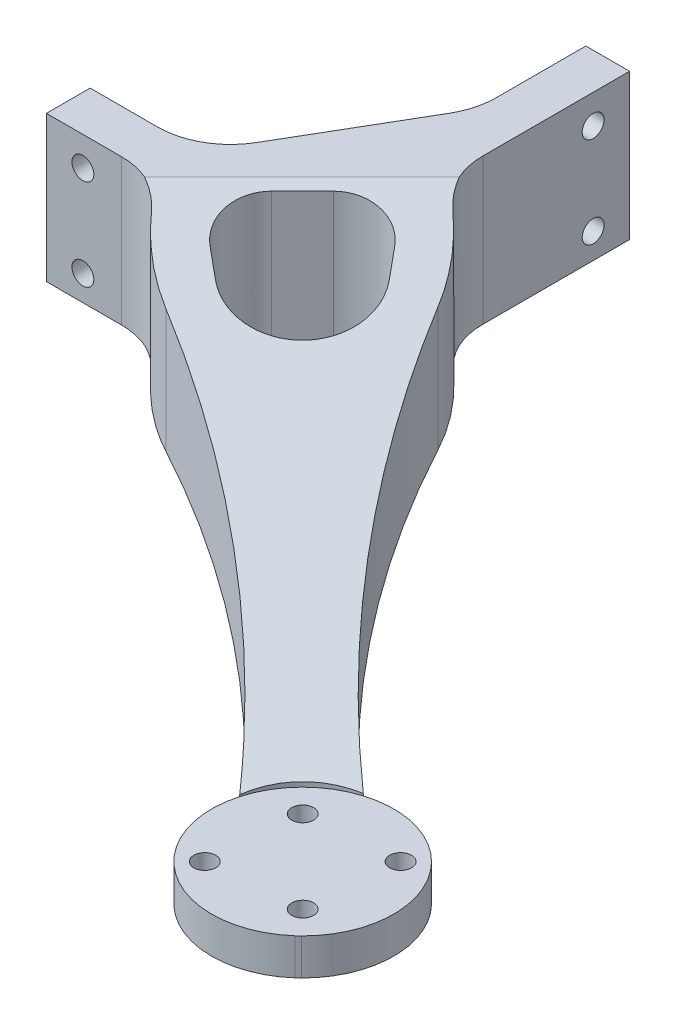
from build123d import *

# Parameters (mm, degrees)
BOSS_EXTRUDE3_DEPTH     = 25
FILLET2_R               = 30
SKETCH2_R               = 1.5
CUT_EXTRUDE1_DEPTH      = 25
SKETCH3_R               = 1.5
CUT_EXTRUDE2_DEPTH      = 25
CUT_EXTRUDE4_DEPTH      = 25
FILLET3_R               = 6
BOSS_EXTRUDE4_DEPTH     = 25
CUT_EXTRUDE6_DEPTH      = 100
CUT_EXTRUDE6_DEPTH_BACK = 100
SKETCH10_W              = 160.183879056
SKETCH10_H              = 83.114276869
SKETCH11_R              = 12.5
BOSS_EXTRUDE5_DEPTH     = 5
CUT_EXTRUDE7_START      = 100
SKETCH12_R              = 12.5
CUT_EXTRUDE7_DEPTH      = 100
FILLET5_R               = 10
BOSS_EXTRUDE9_DEPTH     = 20
CUT_EXTRUDE9_DEPTH      = 100
SKETCH15_W              = 10
SKETCH15_H              = 5
CUT_EXTRUDE10_DEPTH     = 100
SKETCH16_R              = 1.5
CUT_EXTRUDE11_DEPTH     = 10
SKETCH17_R              = 1.5
CUT_EXTRUDE12_DEPTH     = 10
FILLET7_R               = 10
SKETCH18_R              = 1.5
CUT_EXTRUDE14_DEPTH     = 10
BOSS_EXTRUDE10_DEPTH    = 7
SKETCH21_R              = 1.5
CUT_EXTRUDE15_DEPTH     = 7
FILLET8_R               = 3.5
BOSS_EXTRUDE13_DEPTH    = 5
CUT_EXTRUDE16_DEPTH     = 5
CUT_EXTRUDE18_DEPTH     = 5
FILLET10_R              = 1
BOSS_EXTRUDE14_START    = 1
SKETCH27_W              = 15
SKETCH27_H              = 20
SKETCH27_R              = 1.5
BOSS_EXTRUDE14_DEPTH    = 1
BOSS_EXTRUDE15_START    = 1
SKETCH28_W              = 15
SKETCH28_H              = 20
SKETCH28_R              = 1.5
BOSS_EXTRUDE15_DEPTH    = 1
BOSS_EXTRUDE16_DEPTH    = 20
FILLET11_R              = 10


with BuildPart() as part:
    # Sketch1 → Boss-Extrude3 (new body)
    with BuildSketch(Plane(origin=(0, 0, 0), x_dir=(1, 0, 0), z_dir=(0, 1, 0))):
        with BuildLine():
            Line((-32.833333333, 3.166666667), (-17.833333333, 3.166666667))
            Line((-17.833333333, 3.166666667), (7.166666667, 18.166666667))
            Line((7.166666667, 18.166666667), (7.166666667, 33.166666667))
            Line((7.166666667, 33.166666667), (12.166666667, 33.166666667))
            Line((12.166666667, 33.166666667), (12.166666667, 18.166666667))
            Line((12.166666667, 18.166666667), (17.527177031, 18.166666667))
            ThreePointArc((17.527177031, 18.166666667), (37.442198793, -17.327342211), (66.165661867, -46.161270611))
            ThreePointArc((66.165661867, -46.161270611), (72.395526252, -62.062192918), (56.494603945, -55.832328533))
            ThreePointArc((56.494603945, -55.832328533), (27.660675544, -27.10886546), (-7.833333333, -7.193843698))
            Line((-7.833333333, -7.193843698), (-7.833333333, -1.833333333))
            Line((-7.833333333, -1.833333333), (-32.833333333, -1.833333333))
            Line((-32.833333333, -1.833333333), (-32.833333333, 3.166666667))
        make_face()
    extrude(amount=BOSS_EXTRUDE3_DEPTH)

    # Chamfer2
    # the kernel refuses this chamfer: 6, 5.627229018 mm, written as the material it takes off along each edge
    with BuildSketch(Plane(origin=(17.527177031, -14.820831596, -18.166666667), x_dir=(-0.9997164223008481, 0, -0.023813336221376217), z_dir=(0, 1, 0))) as chamfer2_piece_1_section:
        with BuildLine():
            Line((5.702702936, 0), (-2.525905891, 5.363294445))
            Line((-2.525905891, 5.363294445), (-2.634618021, 5.31248428))
            ThreePointArc((-2.634618021, 5.31248428), (-1.288030314, 2.670484416), (-0.110572005, -0.046624369))
            Line((-0.110572005, -0.046624369), (0.0028576, -0.119965971))
            ThreePointArc((0.0028576, -0.119965971), (2.852592138, -0.052085034), (5.705560536, -0.119965971))
            Line((5.705560536, -0.119965971), (5.702702936, 0))
        make_face()
    chamfer2_piece_1 = extrude(amount=54.641663192, mode=Mode.PRIVATE)
    chamfer2_piece_1 = split(chamfer2_piece_1, bisect_by=Plane(origin=(12.166666667, 12.5, -16.425975933), z_dir=(1, 0, 0)), keep=Keep.TOP, mode=Mode.PRIVATE)
    add(chamfer2_piece_1, mode=Mode.SUBTRACT)
    with BuildSketch(Plane(origin=(-7.833333333, -15.240510768, 7.193843698), x_dir=(-0.020819858729133396, 0, -0.999783243249505), z_dir=(0, 1, 0))) as chamfer2_piece_2_section:
        with BuildLine():
            Line((6.096204307, 0), (-2.361428154, -5.028621182))
            Line((-2.361428154, -5.028621182), (-2.470415157, -4.978403325))
            ThreePointArc((-2.470415157, -4.978403325), (-1.204815622, -2.503704319), (-0.110711113, 0.046293083))
            Line((-0.110711113, 0.046293083), (0.002498383, 0.119973989))
            ThreePointArc((0.002498383, 0.119973989), (3.049279286, 0.056526689), (6.09870269, 0.119973989))
            Line((6.09870269, 0.119973989), (6.096204307, 0))
        make_face()
    chamfer2_piece_2 = extrude(amount=55.481021536, mode=Mode.PRIVATE)
    chamfer2_piece_2 = split(chamfer2_piece_2, bisect_by=Plane(origin=(-6.193350631, 12.5, 1.833333333), z_dir=(0, 0, 1)), keep=Keep.TOP, mode=Mode.PRIVATE)
    add(chamfer2_piece_2, mode=Mode.SUBTRACT)

    # Fillet2
    # the kernel refuses this fillet: 30 mm, written as the material it takes off along each edge
    with BuildSketch(Plane(origin=(19.726764246, 45.355475944, -12.880543269), x_dir=(0.42429011681478046, 0, 0.9055263092662189), z_dir=(0, -1, 0))) as fillet2_piece_1:
        with BuildLine():
            CenterArc((8.176045785, 29.990790911), FILLET2_R, 239.5660286, 29.014271836)
            Line((-7.020306331, 4.124386399), (0, 0))
            ThreePointArc((0, 0), (3.716384448, 0.046045445), (7.432768895, 0))
        make_face()
    extrude(amount=65.710951888, mode=Mode.SUBTRACT)
    with BuildSketch(Plane(origin=(-2.883559651, 47.152983024, 9.246371963), x_dir=(0.9056360428972143, 0, 0.4240558427913414), z_dir=(0, -1, 0))) as fillet2_piece_2_section:
        with BuildLine():
            CenterArc((8.898038247, -29.989092358), FILLET2_R, 91.545096469, 31.436731661)
            Line((-7.433152225, -4.823794471), (0, 0))
            ThreePointArc((0, 0), (4.044562839, -0.05453821), (8.089125679, 0))
        make_face()
    fillet2_piece_2 = extrude(amount=69.305966049, mode=Mode.PRIVATE)
    fillet2_piece_2 = split(fillet2_piece_2, bisect_by=Plane(origin=(-2.472074329, 12.5, 1.833333333), z_dir=(0, 0, 1)), keep=Keep.TOP, mode=Mode.PRIVATE)
    add(fillet2_piece_2, mode=Mode.SUBTRACT)

    # Sketch2 → Cut-Extrude1 (cut)
    with BuildSketch(Plane.XY.offset(1.833333333)):
        with Locations((-27.833333333, 20)):
            Circle(SKETCH2_R)
        with Locations((-27.833333333, 7.5)):
            Circle(SKETCH2_R)
    extrude(amount=-CUT_EXTRUDE1_DEPTH, mode=Mode.SUBTRACT)

    # Sketch3 → Cut-Extrude2 (cut)
    with BuildSketch(Plane(origin=(12.166666667, 0, 0), x_dir=(0, 0, -1), z_dir=(1, 0, 0))):
        with Locations((28.166666667, 20)):
            Circle(SKETCH3_R)
        with Locations((28.166666667, 7.5)):
            Circle(SKETCH3_R)
    extrude(amount=-CUT_EXTRUDE2_DEPTH, mode=Mode.SUBTRACT)

    # Sketch4 → Cut-Extrude4 (cut)
    with BuildSketch(Plane(origin=(0, 25, 0), x_dir=(1, 0, 0), z_dir=(0, 1, 0))):
        with BuildLine():
            Line((17.165160832, 5.209143376), (10.448403781, 13.869842848))
            Line((10.448403781, 13.869842848), (-3.421439067, 0))
            Line((-3.421439067, 0), (5.239260404, -6.716757051))
            ThreePointArc((5.239260404, -6.716757051), (16.458811421, -6.01040764), (17.165160832, 5.209143376))
        make_face()
    extrude(amount=-CUT_EXTRUDE4_DEPTH, mode=Mode.SUBTRACT)

    # Fillet3
    fillet3_edges = [part.edges().sort_by_distance(p)[0] for p in [
        (-3.421439067, 12.5, 0),
        (10.448403781, 12.5, -13.869842848),
    ]]
    fillet(fillet3_edges, radius=FILLET3_R)

    # Sketch7 → Boss-Extrude4 (add)
    with BuildSketch(Plane(origin=(0, 25, 0), x_dir=(1, 0, 0), z_dir=(0, 1, 0))):
        Polygon((8.953526914, 27.464178608), (42.758807377, -6.341101855), (46.775588972, -2.324320261), (12.970308509, 31.480960203), align=None)
    extrude(amount=BOSS_EXTRUDE4_DEPTH)

    # Sketch10 → Cut-Extrude6 (cut, two sides: drawn at the far end of the back side and taken through both)
    with BuildSketch(Plane(origin=(22.225634356, 0, -22.225634356), x_dir=(-0.7071067811865475, 0, -0.7071067811865477), z_dir=(0.7071067811865477, 0, -0.7071067811865475)).offset(-CUT_EXTRUDE6_DEPTH_BACK)):
        with Locations((-36.711585848, 10.87638512)):
            Rectangle(SKETCH10_W, SKETCH10_H)
        Polygon((-95.075965008, 0), (-95.075965008, 5), (-72.575965008, 5), (4.173398499, 25), (18.384776311, 25), (25.455844123, 25), (25.455844123, 5), (18.384776311, 5), (4.173398499, 5), (-65.075965008, 0), align=None, mode=Mode.SUBTRACT)
    extrude(amount=CUT_EXTRUDE6_DEPTH + CUT_EXTRUDE6_DEPTH_BACK, mode=Mode.SUBTRACT)

    # Sketch11 → Boss-Extrude5 (add)
    with BuildSketch(Plane(origin=(0, 5, 0), x_dir=(1, 0, 0), z_dir=(0, 1, 0))):
        with Locations((63.634495769, -53.146232797)):
            Circle(SKETCH11_R)
    extrude(amount=-BOSS_EXTRUDE5_DEPTH)

    # Sketch12 → Cut-Extrude7 (cut)
    with BuildSketch(Plane(origin=(0, 5, 0), x_dir=(1, 0, 0), z_dir=(0, 1, 0)).offset(CUT_EXTRUDE7_START)):
        with Locations((63.634495769, -53.146232797)):
            Circle(SKETCH12_R)
    extrude(amount=-CUT_EXTRUDE7_DEPTH, mode=Mode.SUBTRACT)

    # Fillet5
    fillet5_edges = [part.edges().sort_by_distance(p)[0] for p in [
        (-17.833333333, 15, -3.166666667),
        (7.166666667, 15, -18.166666667),
    ]]
    fillet(fillet5_edges, radius=FILLET5_R)

    # Sketch13 → Boss-Extrude9 (add)
    with BuildSketch(Plane(origin=(0, 25, 0), x_dir=(1, 0, 0), z_dir=(0, 1, 0))):
        Polygon((-32.833333333, 3.166666667), (-7.833333333, 3.166666667), (7.166666667, 28.166666667), (7.166666667, 43.166666667), (12.166666667, 43.166666667), (12.166666667, 18.068743425), (-7.735410091, -1.833333333), (-32.833333333, -1.833333333), align=None)
    extrude(amount=-BOSS_EXTRUDE9_DEPTH)

    # Sketch14 → Cut-Extrude9 (cut)
    with BuildSketch(Plane(origin=(0, 25, 0), x_dir=(1, 0, 0), z_dir=(0, 1, 0))):
        Polygon((-23.490794192, 3.166666667), (-7.833333333, 3.166666667), (-1.163922491, 14.282351403), align=None)
    extrude(amount=-CUT_EXTRUDE9_DEPTH, mode=Mode.SUBTRACT)

    # Sketch15 → Cut-Extrude10 (cut)
    with BuildSketch(Plane(origin=(0, 25, 0), x_dir=(1, 0, 0), z_dir=(0, 1, 0))):
        with Locations((-27.833333333, 0.666666667)):
            Rectangle(SKETCH15_W, SKETCH15_H)
    extrude(amount=-CUT_EXTRUDE10_DEPTH, mode=Mode.SUBTRACT)

    # Sketch16 → Cut-Extrude11 (cut)
    with BuildSketch(Plane.ZY.offset(-7.166666667)):
        with Locations((-38.166666667, 21)):
            Circle(SKETCH16_R)
        with Locations((-38.166666667, 8.5)):
            Circle(SKETCH16_R)
    extrude(amount=-CUT_EXTRUDE11_DEPTH, mode=Mode.SUBTRACT)

    # Sketch17 → Cut-Extrude12 (cut)
    with BuildSketch(Plane(origin=(0, 0, -3.166666667), x_dir=(-1, 0, 0), z_dir=(0, 0, -1))):
        with Locations((17.833333333, 21)):
            Circle(SKETCH17_R)
        with Locations((17.833333333, 8.5)):
            Circle(SKETCH17_R)
    extrude(amount=-CUT_EXTRUDE12_DEPTH, mode=Mode.SUBTRACT)

    # Fillet7
    # the kernel refuses this fillet: 10 mm, written as the material it adds along each edge
    with BuildSketch(Plane(origin=(-7.502347281, -7.577664342, 1.833333333), x_dir=(-1, 0, 0), z_dir=(0, 1, 0))) as fillet7_piece_1_section:
        with BuildLine():
            CenterArc((5.026306118, 10), FILLET7_R, 220.490539219, 49.509460781)
            ThreePointArc((-2.578825815, 3.506775201), (-1.225726194, 1.80022178), (0, 0))
            Line((0, 0), (5.026306118, 0))
        make_face()
    fillet7_piece_1 = extrude(amount=45.100484579, mode=Mode.PRIVATE)
    fillet7_piece_1 = split(fillet7_piece_1, bisect_by=Plane(origin=(-6.299503341, 5, 3.722138351), z_dir=(0, -1, 0)), keep=Keep.TOP, mode=Mode.PRIVATE)
    fillet7_piece_1 = split(fillet7_piece_1, bisect_by=Plane(origin=(-6.303814006, 4.830696636, 3.717827687), z_dir=(0.05092254709852862, 0.9974035233515051, 0.05092254709852862)), keep=Keep.TOP, mode=Mode.PRIVATE)
    add(fillet7_piece_1)
    with BuildSketch(Plane(origin=(-7.502347281, -7.577664342, 1.833333333), x_dir=(-1, 0, 0), z_dir=(0, 1, 0))) as fillet7_piece_2_section:
        with BuildLine():
            CenterArc((5.026306118, 10), FILLET7_R, 220.490539219, 49.509460781)
            ThreePointArc((-2.578825815, 3.506775201), (-1.225726194, 1.80022178), (0, 0))
            Line((0, 0), (5.026306118, 0))
        make_face()
    fillet7_piece_2 = extrude(amount=45.100484579, mode=Mode.PRIVATE)
    fillet7_piece_2 = split(fillet7_piece_2, bisect_by=Plane(origin=(-10.467928875, 5, 1.847831753), z_dir=(0, 1, 0)), keep=Keep.TOP, mode=Mode.PRIVATE)
    fillet7_piece_2 = split(fillet7_piece_2, bisect_by=Plane(origin=(-10.464404817, 5.138408988, 1.85135581), z_dir=(-0.05092254709852862, -0.9974035233515051, -0.05092254709852862)), keep=Keep.TOP, mode=Mode.PRIVATE)
    add(fillet7_piece_2)
    with BuildSketch(Plane(origin=(-7.502347281, -7.577664342, 1.833333333), x_dir=(-1, 0, 0), z_dir=(0, 1, 0))) as fillet7_piece_3_section:
        with BuildLine():
            CenterArc((5.026306118, 10), FILLET7_R, 220.490539219, 49.509460781)
            ThreePointArc((-2.578825815, 3.506775201), (-1.225726194, 1.80022178), (0, 0))
            Line((0, 0), (5.026306118, 0))
        make_face()
    fillet7_piece_3 = extrude(amount=45.100484579, mode=Mode.PRIVATE)
    fillet7_piece_3 = split(fillet7_piece_3, bisect_by=Plane(origin=(-8.143046579, 25, 2.567869608), z_dir=(0, -1, 0)), keep=Keep.TOP, mode=Mode.PRIVATE)
    fillet7_piece_3 = split(fillet7_piece_3, bisect_by=Plane(origin=(-8.143046579, 5, 2.567869608), z_dir=(0, 1, 0)), keep=Keep.TOP, mode=Mode.PRIVATE)
    fillet7_piece_3 = split(fillet7_piece_3, bisect_by=Plane(origin=(-6.413698514, 24.302451402, 4.297217673), z_dir=(-0.17830914996233782, -0.9676836745958967, -0.17830914996233793)), keep=Keep.TOP, mode=Mode.PRIVATE)
    fillet7_piece_3 = split(fillet7_piece_3, bisect_by=Plane(origin=(-8.64759618, 5.034829767, 2.063320006), z_dir=(0.05092254709852862, 0.9974035233515051, 0.05092254709852862)), keep=Keep.TOP, mode=Mode.PRIVATE)
    add(fillet7_piece_3)
    with BuildSketch(Plane(origin=(12.166666667, 25, -18.068743425), x_dir=(0, 0, -1), z_dir=(0, -1, 0))) as fillet7_piece_4_section:
        with BuildLine():
            CenterArc((4.970504995, 10), FILLET7_R, 220.783942831, 49.216057169)
            Line((-2.601276479, 3.467915699), (-3.358454626, 2.814707269))
            ThreePointArc((-3.358454626, 2.814707269), (-1.405583009, 0.280875666), (-0.824518548, -0.565834927))
            Line((-0.824518548, -0.565834927), (0, -1))
            Line((0, -1), (4.970504995, -1))
            Line((4.970504995, -1), (4.970504995, 0))
        make_face()
    fillet7_piece_4 = extrude(amount=20, mode=Mode.PRIVATE)
    fillet7_piece_4 = split(fillet7_piece_4, bisect_by=Plane(origin=(14.359334309, 24.376039861, -16.875179681), z_dir=(-0.17830914996233782, -0.9676836745958967, -0.17830914996233793)), keep=Keep.TOP, mode=Mode.PRIVATE)
    fillet7_piece_4 = split(fillet7_piece_4, bisect_by=Plane(origin=(12.113566037, 5.056431477, -19.120947952), z_dir=(0.05092254709852862, 0.9974035233515051, 0.05092254709852862)), keep=Keep.TOP, mode=Mode.PRIVATE)
    add(fillet7_piece_4)
    with BuildSketch(Plane(origin=(12.166666667, 25, -18.068743425), x_dir=(0, 0, -1), z_dir=(0, -1, 0))) as fillet7_piece_5_section:
        with BuildLine():
            CenterArc((4.970504995, 10), FILLET7_R, 220.783942831, 49.216057169)
            Line((-2.601276479, 3.467915699), (-3.358454626, 2.814707269))
            ThreePointArc((-3.358454626, 2.814707269), (-1.405583009, 0.280875666), (-0.824518548, -0.565834927))
            Line((-0.824518548, -0.565834927), (0, -1))
            Line((0, -1), (4.970504995, -1))
            Line((4.970504995, -1), (4.970504995, 0))
        make_face()
    fillet7_piece_5 = extrude(amount=32.426262487, mode=Mode.PRIVATE)
    fillet7_piece_5 = split(fillet7_piece_5, bisect_by=Plane(origin=(14.100710146, 5, -16.202051862), z_dir=(0, -1, 0)), keep=Keep.TOP, mode=Mode.PRIVATE)
    fillet7_piece_5 = split(fillet7_piece_5, bisect_by=Plane(origin=(14.095782292, 4.806456237, -16.206979716), z_dir=(0.05092254709852862, 0.9974035233515051, 0.05092254709852862)), keep=Keep.TOP, mode=Mode.PRIVATE)
    add(fillet7_piece_5)
    with BuildSketch(Plane(origin=(12.166666667, 25, -18.068743425), x_dir=(0, 0, -1), z_dir=(0, -1, 0))) as fillet7_piece_6_section:
        with BuildLine():
            CenterArc((4.970504995, 10), FILLET7_R, 220.783942831, 49.216057169)
            Line((-2.601276479, 3.467915699), (-3.358454626, 2.814707269))
            ThreePointArc((-3.358454626, 2.814707269), (-1.405583009, 0.280875666), (-0.824518548, -0.565834927))
            Line((-0.824518548, -0.565834927), (0, -1))
            Line((0, -1), (4.970504995, -1))
            Line((4.970504995, -1), (4.970504995, 0))
        make_face()
    fillet7_piece_6 = extrude(amount=20, mode=Mode.PRIVATE)
    fillet7_piece_6 = split(fillet7_piece_6, bisect_by=Plane(origin=(11.727300313, 5.177477113, -21.105564101), z_dir=(-0.05092254709852862, -0.9974035233515051, -0.05092254709852862)), keep=Keep.TOP, mode=Mode.PRIVATE)
    add(fillet7_piece_6)

    # Sketch18 → Cut-Extrude14 (cut)
    with BuildSketch(Plane(origin=(0, 5, 0), x_dir=(1, 0, 0), z_dir=(0, 1, 0))):
        with Locations(Location((56.916981348, -59.863747218, 0), (0, 0, 270))):
            Circle(SKETCH18_R)
        with Locations(Location((70.35201019, -46.428718376, 0), (0, 0, 270))):
            Circle(SKETCH18_R)
        with Locations(Location((57.97764152, -47.489378547, 0), (0, 0, 270))):
            Circle(SKETCH18_R)
        with Locations(Location((69.291350019, -58.803087046, 0), (0, 0, 270))):
            Circle(SKETCH18_R)
    extrude(amount=-CUT_EXTRUDE14_DEPTH, mode=Mode.SUBTRACT)

    # Sketch20 → Boss-Extrude10 (add)
    with BuildSketch(Plane.XZ):
        Polygon((65.183134159, 56.81619153), (67.170029675, 54.560446359), (62.220282207, 49.610698891), (60.233386691, 51.866444062), align=None)
    extrude(amount=BOSS_EXTRUDE10_DEPTH)

    # Sketch21 → Cut-Extrude15 (cut)
    with BuildSketch(Plane(origin=(6.304791658, 0, -6.304791658), x_dir=(-0.7071067811865461, 0, -0.707106781186549), z_dir=(0.707106781186549, 0, -0.7071067811865461))):
        with Locations((-82.576445081, -4.5)):
            Circle(SKETCH21_R)
    extrude(amount=-CUT_EXTRUDE15_DEPTH, mode=Mode.SUBTRACT)

    # Fillet8
    # the kernel refuses this fillet: 3.5 mm, written as the material it takes off along each edge
    with BuildSketch(Plane(origin=(59.399622631, -7, 63.382278219), x_dir=(0, 1, 0), z_dir=(0.6609727460873192, 0, -0.7504099072705454)), Plane(origin=(68.003793735, -7, 43.044612202), x_dir=(0, 1, 0), z_dir=(-0.6609727460873219, 0, 0.7504099072705428))) as fillet8_piece_1:
        with BuildLine():
            CenterArc((FILLET8_R, -FILLET8_R), FILLET8_R, 90, 90)
            Line((0, -FILLET8_R), (0, 0))
            Line((0, 0), (FILLET8_R, 0))
        make_face()
    extrude(amount=20.50601731, mode=Mode.SUBTRACT)

    # Sketch24 → Boss-Extrude13 (add)
    with BuildSketch(Plane(origin=(0.23864693, 4.674300528, 0.23864693), x_dir=(-0.9987026054822318, 0.05085630859006412, 0.002596474454724954), z_dir=(-0.05092254709852865, -0.9974035233515052, -0.050922547098528656))):
        Polygon((-43.139964089, -30.785960317), (-41.021401305, -32.904523102), (-38.900080962, -30.783202758), (-41.021401305, -28.661882414), align=None)
    extrude(amount=BOSS_EXTRUDE13_DEPTH)

    # Sketch25 → Cut-Extrude16 (cut)
    with BuildSketch(Plane(origin=(6.22504574, 0, -6.22504574), x_dir=(-0.7071067811865479, 0, -0.7071067811865471), z_dir=(0.7071067811865471, 0, -0.7071067811865479))):
        with BuildLine():
            Line((-49.919303237, -1.47486047), (-49.338024072, -0.72486047))
            Line((-49.338024072, -0.72486047), (-49.410226901, 0.27513953))
            Line((-49.410226901, 0.27513953), (-50.242592935, -0.798827271))
            ThreePointArc((-50.242592935, -0.798827271), (-51.571270298, -1.849539371), (-49.919303237, -1.47486047))
        make_face()
    extrude(amount=-CUT_EXTRUDE16_DEPTH, mode=Mode.SUBTRACT)

    # Sketch26 → Cut-Extrude18 (cut)
    with BuildSketch(Plane(origin=(6.22504574, 0, -6.22504574), x_dir=(-0.7071067811865479, 0, -0.7071067811865471), z_dir=(0.7071067811865471, 0, -0.7071067811865479))):
        Polygon((-53.17088521, -2.605184508), (-47.853660079, -2.824654594), (-48.053771996, -4.778906076), (-52.998057051, -4.922262957), align=None)
    extrude(amount=-CUT_EXTRUDE18_DEPTH, mode=Mode.SUBTRACT)

    # Fillet10
    fillet10_edges = [part.edges().sort_by_distance(p)[0] for p in [
        (39.94863606, -2.769399449, 29.619863131),
        (42.083214828, -2.644880095, 31.751684343),
    ]]
    fillet(fillet10_edges, radius=FILLET10_R)

    # Sketch27 → Boss-Extrude14 (add)
    with BuildSketch(Plane.ZY.offset(-7.166666667).offset(BOSS_EXTRUDE14_START)):
        with Locations((-35.666666667, 15)):
            Rectangle(SKETCH27_W, SKETCH27_H)
        with Locations((-38.166666667, 21)):
            Circle(SKETCH27_R, mode=Mode.SUBTRACT)
        with Locations((-38.166666667, 8.5)):
            Circle(SKETCH27_R, mode=Mode.SUBTRACT)
    extrude(amount=-BOSS_EXTRUDE14_DEPTH)

    # Sketch28 → Boss-Extrude15 (add)
    with BuildSketch(Plane(origin=(0, 0, -3.166666667), x_dir=(-1, 0, 0), z_dir=(0, 0, -1)).offset(BOSS_EXTRUDE15_START)):
        with Locations((15.333333333, 15)):
            Rectangle(SKETCH28_W, SKETCH28_H)
        with Locations((17.833333333, 21)):
            Circle(SKETCH28_R, mode=Mode.SUBTRACT)
        with Locations((17.833333333, 8.5)):
            Circle(SKETCH28_R, mode=Mode.SUBTRACT)
    extrude(amount=-BOSS_EXTRUDE15_DEPTH)

    # Sketch29 → Boss-Extrude16 (add)
    with BuildSketch(Plane(origin=(0, 25, 0), x_dir=(1, 0, 0), z_dir=(0, 1, 0))):
        Polygon((7.166666667, 28.166666667), (-7.833333333, 3.166666667), (-7.833333333, 4.166666667), (6.166666667, 28.166666667), align=None)
    extrude(amount=-BOSS_EXTRUDE16_DEPTH)

    # Fillet11
    fillet11_edges = [part.edges().sort_by_distance(p)[0] for p in [
        (6.166666667, 15, -28.166666667),
        (-7.833333333, 15, -4.166666667),
    ]]
    fillet(fillet11_edges, radius=FILLET11_R)


solid = part.part
